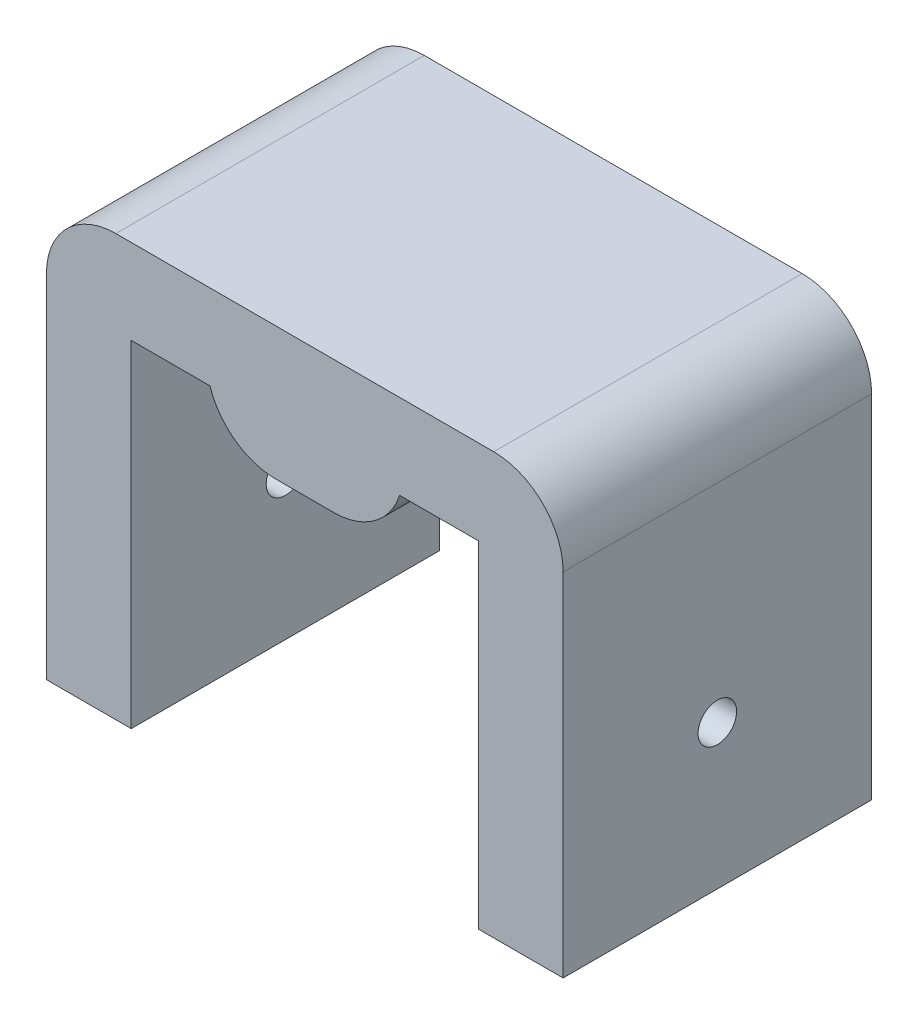
from build123d import *

# Parameters (mm, degrees)
BOSS_EXTRUDE1_DEPTH = 20
FILLET1_R           = 4.5
FILLET2_R           = 4.5
SKETCH2_R           = 1.25
CUT_EXTRUDE1_DEPTH  = 48.618693808


with BuildPart() as part:
    # Sketch1 → Boss-Extrude1 (new body)
    with BuildSketch(Plane.XY):
        Polygon((-16.75, 0), (-16.75, 27.3), (16.75, 27.3), (16.75, 0), (11.25, 0), (11.25, 21.8), (6.15, 21.8), (6.15, 18.7), (-6.15, 18.7), (-6.15, 21.8), (-11.25, 21.8), (-11.25, 0), align=None)
    extrude(amount=BOSS_EXTRUDE1_DEPTH)

    # Fillet1
    fillet1_edges = [part.edges().sort_by_distance(p)[0] for p in [
        (16.75, 27.3, 10),
        (-16.75, 27.3, 10),
    ]]
    fillet(fillet1_edges, radius=FILLET1_R)

    # Fillet2
    # the kernel refuses this fillet: 4.5 mm, written as the material it takes off along each edge
    with BuildSketch(Plane(origin=(-6.15, 18.7, -10.69170239), x_dir=(0, 1, 0), z_dir=(0, 0, 1))) as fillet2_piece_1:
        with BuildLine():
            CenterArc((4.5, -4.276680956), FILLET2_R, 108.126203961, 71.873796039)
            Line((0, -4.276680956), (-0.09, -4.276680956))
            Line((-0.09, -4.276680956), (-0.09, 0))
            Line((-0.09, 0), (0, 0.09))
            ThreePointArc((0, 0.09), (1.55, 0.09), (3.072, 0.085533619))
            Line((3.072, 0.085533619), (3.1, 0))
        make_face()
    extrude(amount=41.38340478, mode=Mode.SUBTRACT)
    with BuildSketch(Plane(origin=(6.15, 18.7, -10.69170239), x_dir=(-1, 0, 0), z_dir=(0, 0, 1))) as fillet2_piece_2:
        with BuildLine():
            CenterArc((4.276680956, -4.5), FILLET2_R, 90, 71.873796039)
            Line((0, -3.1), (-0.085533619, -3.072))
            ThreePointArc((-0.085533619, -3.072), (-0.09, -1.55), (-0.09, 0))
            Line((-0.09, 0), (0, 0.09))
            Line((0, 0.09), (4.276680956, 0.09))
            Line((4.276680956, 0.09), (4.276680956, 0))
        make_face()
    extrude(amount=41.38340478, mode=Mode.SUBTRACT)

    # Sketch2 → Cut-Extrude1 (cut, through all)
    with BuildSketch(Plane(origin=(16.75, 0, 0), x_dir=(0, 0, -1), z_dir=(1, 0, 0))):
        with Locations(Location((-10, 9.35, 0), (0, 0, 90))):
            Circle(SKETCH2_R)
    extrude(amount=-CUT_EXTRUDE1_DEPTH, mode=Mode.SUBTRACT)


solid = part.part
